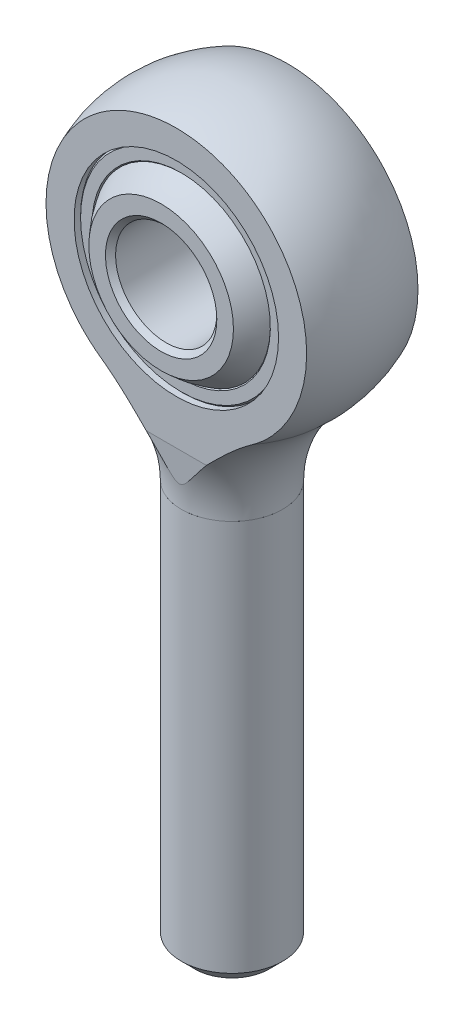
from build123d import *

# Parameters (mm, degrees)
SKETCH1_W               = 3.96875
SKETCH1_H               = 31.75
CHAMFER2_SIZE           = 1.058333333
CUT_EXTRUDE1_DEPTH      = 36.426512847
CUT_EXTRUDE1_DEPTH_BACK = 36.426512847
CUT_EXTRUDE2_DEPTH      = 34.920625566
CUT_EXTRUDE2_DEPTH_BACK = 34.920625566
SKETCH6_R               = 8.016875
CUT_EXTRUDE3_DEPTH      = 35.562321428
CUT_EXTRUDE3_DEPTH_BACK = 35.562321428
SKETCH8_W               = 5.55625
SKETCH8_H               = 26.9875
CUT_EXTRUDE4_DEPTH      = 35.562321428
CUT_EXTRUDE4_DEPTH_BACK = 35.562321428
SKETCH10_R              = 3.96875
CHAMFER1_SIZE           = 0.396875
CHAMFER3_SIZE           = 0.127
CHAMFER3_PART_2_SIZE    = 0.127
CHAMFER3_PART_2_SIZE2   = 0.092913167
CHAMFER4_SIZE           = 0.127
CHAMFER4_SIZE2          = 0.092913167
CHAMFER4_PART_2_SIZE    = 0.127


with BuildPart() as part:
    # Sketch1 → Revolve1 (revolve)
    with BuildSketch(Plane.XY):
        with Locations((1.984375, -15.875)):
            Rectangle(SKETCH1_W, SKETCH1_H)
    revolve(axis=Axis((0, 26.9875, 0), (0, -1, 0)))

    # Chamfer2
    chamfer2_edges = [part.edges().sort_by_distance(p)[0] for p in [
        (-3.96875, -31.75, 0),
    ]]
    chamfer(chamfer2_edges, length=CHAMFER2_SIZE)


with BuildPart() as body_2:
    # Sketch4 → Revolve2 (revolve)
    with BuildSketch(Plane.XY):
        with BuildLine():
            Line((3.96875, 0), (0, 0))
            Line((0, 0), (0, 26.9875))
            ThreePointArc((0, 26.9875), (10.390160011, 19.816095177), (7.369828482, 7.557952183))
            ThreePointArc((7.369828482, 7.557952183), (4.858189884, 4.143970802), (3.96875, 0))
        make_face()
    revolve(axis=Axis((0, 26.9875, 0), (0, 1, 0)))

    # Sketch5 → Cut-Extrude1 (cut, two sides: drawn at the far end of the back side and taken through both)
    with BuildSketch(Plane(origin=(0, 0, 0), x_dir=(0, 0, -1), z_dir=(1, 0, 0)).offset(-CUT_EXTRUDE1_DEPTH_BACK)):
        Polygon((4.365625, 26.9875), (11.1125, 26.9875), (11.1125, 0), (3.96875, 0), (4.365625, 4.365625), align=None)
        Polygon((-4.365625, 26.9875), (-4.365625, 4.365625), (-3.96875, 0), (-11.1125, 0), (-11.1125, 26.9875), align=None)
    extrude(amount=CUT_EXTRUDE1_DEPTH + CUT_EXTRUDE1_DEPTH_BACK, mode=Mode.SUBTRACT)

    # Sketch6 → Cut-Extrude2 (cut, two sides: drawn at the far end of the back side and taken through both)
    with BuildSketch(Plane.XY.offset(-CUT_EXTRUDE2_DEPTH_BACK)):
        with Locations((0, 15.875)):
            Circle(SKETCH6_R)
    extrude(amount=CUT_EXTRUDE2_DEPTH + CUT_EXTRUDE2_DEPTH_BACK, mode=Mode.SUBTRACT)


with BuildPart() as body_3:
    # Sketch7 → Revolve3 (revolve)
    with BuildSketch(Plane.XY):
        with BuildLine():
            Line((0, 23.8125), (0, 7.9375))
            ThreePointArc((0, 7.9375), (7.9375, 15.875), (0, 23.8125))
        make_face()
    revolve(axis=Axis((0, 0, 0), (0, 1, 0)))

    # Sketch8 → Cut-Extrude3 (cut, two sides: drawn at the far end of the back side and taken through both)
    with BuildSketch(Plane(origin=(0, 0, 0), x_dir=(0, 0, -1), z_dir=(1, 0, 0)).offset(-CUT_EXTRUDE3_DEPTH_BACK)):
        with Locations((-8.334375, 13.49375)):
            Rectangle(SKETCH8_W, SKETCH8_H)
        with Locations((8.334375, 13.49375)):
            Rectangle(SKETCH8_W, SKETCH8_H)
    extrude(amount=CUT_EXTRUDE3_DEPTH + CUT_EXTRUDE3_DEPTH_BACK, mode=Mode.SUBTRACT)

    # Sketch10 → Cut-Extrude4 (cut, two sides: drawn at the far end of the back side and taken through both)
    with BuildSketch(Plane.XY.offset(-CUT_EXTRUDE4_DEPTH_BACK)):
        with Locations((0, 15.875)):
            Circle(SKETCH10_R)
    extrude(amount=CUT_EXTRUDE4_DEPTH + CUT_EXTRUDE4_DEPTH_BACK, mode=Mode.SUBTRACT)

    # Chamfer1
    chamfer1_edges = [body_3.edges().sort_by_distance(p)[0] for p in [
        (-3.96875, 15.875, -5.55625),
        (-3.96875, 15.875, 5.55625),
    ]]
    chamfer(chamfer1_edges, length=CHAMFER1_SIZE)


with BuildPart() as body_4:
    # Sketch14 → Revolve4 (revolve)
    with BuildSketch(Plane(origin=(0, 0, 0), x_dir=(0, 0, -1), z_dir=(1, 0, 0))):
        with BuildLine():
            Line((-3.984625, 23.891875), (-3.984625, 22.739886733))
            ThreePointArc((-3.984625, 22.739886733), (-2.855730726, 23.280991377), (-1.655801312, 23.637875))
            Line((-1.655801312, 23.637875), (-1.655801312, 23.891875))
            Line((-1.655801312, 23.891875), (-3.984625, 23.891875))
        make_face()
        with BuildLine():
            Line((3.984625, 22.739886733), (3.984625, 23.891875))
            Line((3.984625, 23.891875), (1.655801312, 23.891875))
            Line((1.655801312, 23.891875), (1.655801312, 23.637875))
            ThreePointArc((1.655801312, 23.637875), (2.855730726, 23.280991377), (3.984625, 22.739886733))
        make_face()
    revolve(axis=Axis((0, 15.875, 5.55625), (0, 0, -1)))

    # Chamfer3
    chamfer3_edges = [body_4.edges().sort_by_distance(p)[0] for p in [
        (0, 7.858125, 3.984625),
    ]]
    chamfer(chamfer3_edges, length=CHAMFER3_SIZE)

    # Chamfer3 part 2
    chamfer3_part_2_edges = [body_4.edges().sort_by_distance(p)[0] for p in [
        (0, 9.010113267, 3.984625),
    ]]
    chamfer3_part_2_side = [body_4.faces().sort_by_distance(p)[0] for p in [
        (0, 8.084876467, 3.984625),
    ]]
    chamfer(chamfer3_part_2_edges, length=CHAMFER3_PART_2_SIZE, length2=CHAMFER3_PART_2_SIZE2, reference=chamfer3_part_2_side[0])

    # Chamfer4
    chamfer4_edges = [body_4.edges().sort_by_distance(p)[0] for p in [
        (0, 9.010113267, -3.984625),
    ]]
    chamfer4_side = [body_4.faces().sort_by_distance(p)[0] for p in [
        (0, 8.469008623, -2.855730726),
    ]]
    chamfer(chamfer4_edges, length=CHAMFER4_SIZE, length2=CHAMFER4_SIZE2, reference=chamfer4_side[0])

    # Chamfer4 part 2
    chamfer4_part_2_edges = [body_4.edges().sort_by_distance(p)[0] for p in [
        (0, 7.858125, -3.984625),
    ]]
    chamfer(chamfer4_part_2_edges, length=CHAMFER4_PART_2_SIZE)


solid = Compound([part.part, body_2.part, body_3.part, body_4.part])
